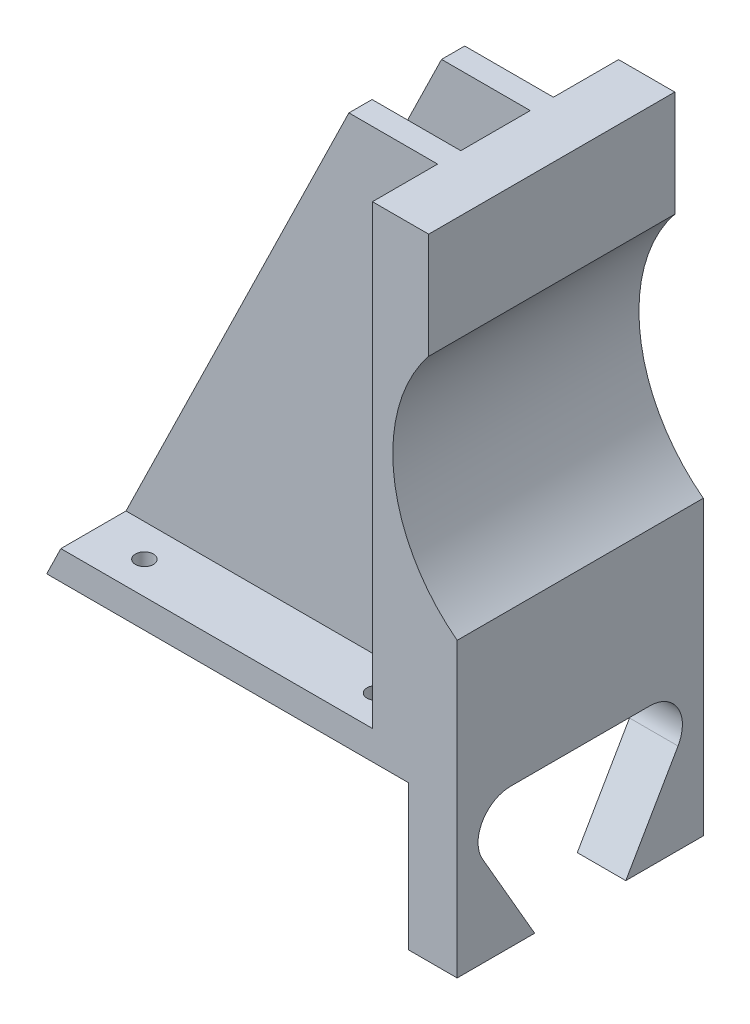
from build123d import *

# Parameters (mm, degrees)
BOSS_EXTRUDE2_DEPTH = 34
SKETCH5_W           = 50
SKETCH5_H           = 20
CUT_EXTRUDE1_DEPTH  = 9
SKETCH6_W           = 50
SKETCH6_H           = 20
CUT_EXTRUDE2_DEPTH  = 9
SKETCH7_W           = 52.006330756
SKETCH7_H           = 21.627895193
CUT_EXTRUDE3_DEPTH  = 87.963406183
CUT_EXTRUDE4_DEPTH  = 102.507335876
SKETCH10_R          = 1.25
CUT_EXTRUDE5_DEPTH  = 10
SKETCH11_W          = 9.6
SKETCH11_H          = 36.3
CUT_EXTRUDE6_DEPTH  = 24.6
SKETCH12_W          = 12.3
SKETCH12_H          = 9.6
BOSS_EXTRUDE3_DEPTH = 6
SKETCH13_R          = 1.5
CUT_EXTRUDE7_DEPTH  = 87.963406183


with BuildPart() as part:
    # Sketch4 → Boss-Extrude2 (new body)
    with BuildSketch(Plane.XY):
        with BuildLine():
            Line((-25, -10), (31.702104436, -10))
            Line((31.702104436, -10), (31.702104436, 30.398563958))
            ThreePointArc((31.702104436, 30.398563958), (22.978895732, 45.572200501), (27.765437219, 62.407361226))
            Line((27.765437219, 62.407361226), (27.765437219, 77.023441816))
            Line((27.765437219, 77.023441816), (7.747226033, 77.023441816))
            Line((7.747226033, 77.023441816), (-25, 10))
            Line((-25, 10), (-25, -10))
        make_face()
    extrude(amount=BOSS_EXTRUDE2_DEPTH)

    # Sketch5 → Cut-Extrude1 (cut)
    with BuildSketch(Plane.XY.offset(34)):
        Polygon((-23.045625522, 14), (7.747226033, 77.023441816), (20, 77.023441816), (20, 14), align=None)
        Rectangle(SKETCH5_W, SKETCH5_H)
    extrude(amount=-CUT_EXTRUDE1_DEPTH, mode=Mode.SUBTRACT)

    # Sketch6 → Cut-Extrude2 (cut)
    with BuildSketch(Plane(origin=(0, 0, 0), x_dir=(-1, 0, 0), z_dir=(0, 0, -1))):
        Polygon((23.045625522, 14), (-20, 14), (-20, 77.023441816), (-7.747226033, 77.023441816), align=None)
        Rectangle(SKETCH6_W, SKETCH6_H)
    extrude(amount=-CUT_EXTRUDE2_DEPTH, mode=Mode.SUBTRACT)

    # Sketch7 → Cut-Extrude3 (cut, through all)
    with BuildSketch(Plane(origin=(0, 0, 9), x_dir=(-1, 0, 0), z_dir=(0, 0, -1))):
        with Locations((1.003165378, -0.813947597)):
            Rectangle(SKETCH7_W, SKETCH7_H)
    extrude(amount=-CUT_EXTRUDE3_DEPTH, mode=Mode.SUBTRACT)

    # Sketch9 → Cut-Extrude4 (cut, through all)
    with BuildSketch(Plane(origin=(31.702104436, 0, 0), x_dir=(0, 0, -1), z_dir=(1, 0, 0))):
        with BuildLine():
            Line((-26.615, 9.249281979), (-7.385, 9.249281979))
            ThreePointArc((-7.385, 9.249281979), (-3.487778361, 6.999096082), (-3.488100353, 2.498910201))
            Line((-3.488100353, 2.498910201), (-13.103100353, -14.151089799))
            ThreePointArc((-13.103100353, -14.151089799), (-17, -16.400718021), (-20.896899647, -14.151089799))
            Line((-20.896899647, -14.151089799), (-30.511899647, 2.498910201))
            ThreePointArc((-30.511899647, 2.498910201), (-30.512221639, 6.999096082), (-26.615, 9.249281979))
        make_face()
    extrude(amount=-CUT_EXTRUDE4_DEPTH, mode=Mode.SUBTRACT)

    # Sketch10 → Cut-Extrude5 (cut)
    with BuildSketch(Plane.XZ.offset(-10)):
        with Locations((16, 29.5)):
            Circle(SKETCH10_R)
        with Locations((16, 4.5)):
            Circle(SKETCH10_R)
        with Locations((-16, 29.5)):
            Circle(SKETCH10_R)
        with Locations((-16, 4.5)):
            Circle(SKETCH10_R)
    extrude(amount=-CUT_EXTRUDE5_DEPTH, mode=Mode.SUBTRACT)

    # Sketch11 → Cut-Extrude6 (cut)
    with BuildSketch(Plane.ZY.offset(-20)):
        with Locations((17, 58.873441816)):
            Rectangle(SKETCH11_W, SKETCH11_H)
    extrude(amount=CUT_EXTRUDE6_DEPTH, mode=Mode.SUBTRACT)

    # Sketch12 → Boss-Extrude3 (add)
    with BuildSketch(Plane(origin=(0, 40.723441816, 0), x_dir=(1, 0, 0), z_dir=(0, 1, 0))):
        with Locations((1.55, -17)):
            Rectangle(SKETCH12_W, SKETCH12_H)
    extrude(amount=BOSS_EXTRUDE3_DEPTH)

    # Sketch13 → Cut-Extrude7 (cut, through all)
    with BuildSketch(Plane.XY.offset(25)):
        with Locations((13.85, 43.723441816)):
            Circle(SKETCH13_R)
    extrude(amount=-CUT_EXTRUDE7_DEPTH, mode=Mode.SUBTRACT)


solid = part.part
